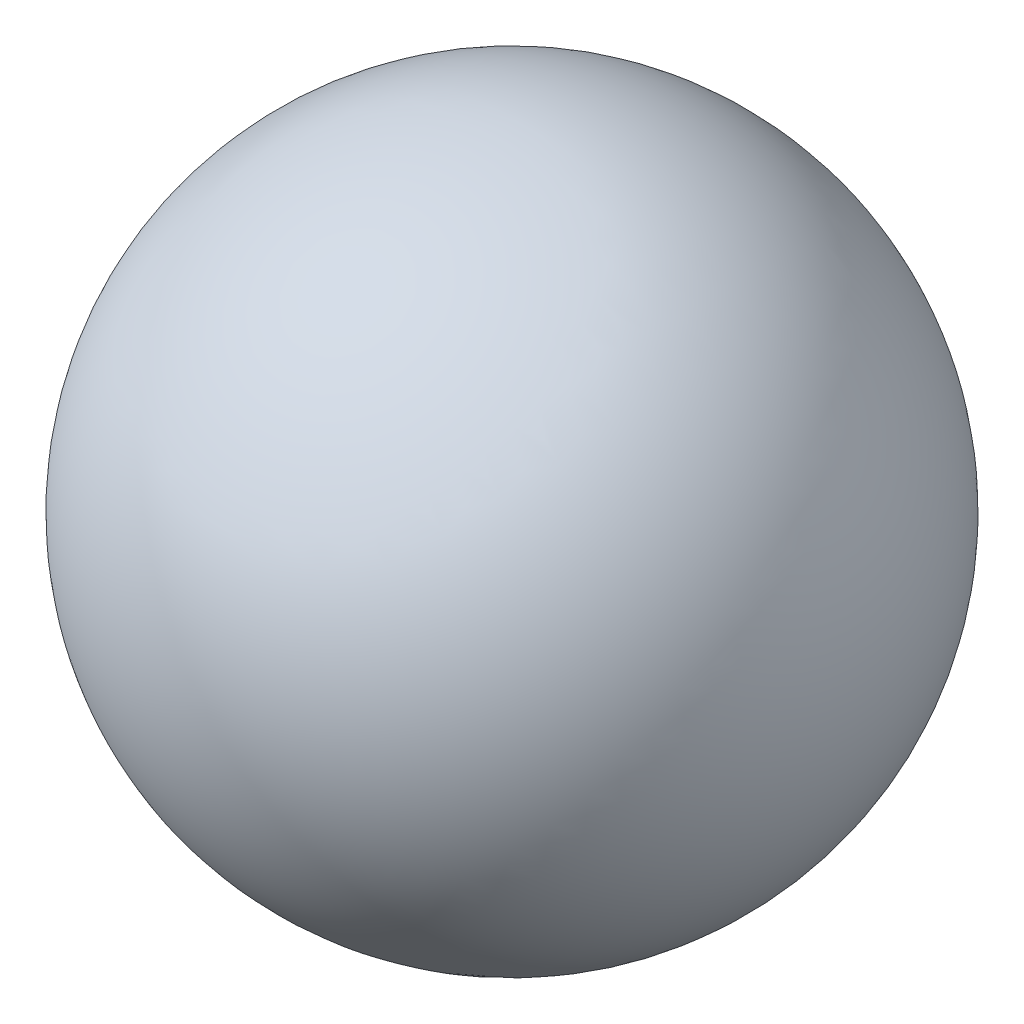
from build123d import *

# Parameters (mm, degrees)
SKETCH3_W          = 13
SKETCH3_H          = 25
CUT_EXTRUDE1_DEPTH = 27
FILLET1_R          = 4


with BuildPart() as part:
    # Sketch2 → Revolve1 (revolve)
    with BuildSketch(Plane(origin=(0, 0, 0), x_dir=(1, 0, 0), z_dir=(0, 1, 0))):
        with BuildLine():
            Line((0, -20), (0, 20))
            ThreePointArc((0, 20), (-20, 0), (0, -20))
        make_face()
    revolve(axis=Axis((0, 0, 20), (0, 0, -1)))

    # Sketch3 → Cut-Extrude1 (cut)
    with BuildSketch(Plane(origin=(0, 0, 0), x_dir=(1, 0, 0), z_dir=(0, 1, 0))):
        Rectangle(SKETCH3_W, SKETCH3_H)
    extrude(amount=-CUT_EXTRUDE1_DEPTH, mode=Mode.SUBTRACT)

    # Fillet1
    fillet1_edges = [part.edges().sort_by_distance(p)[0] for p in [
        (-6.5, -7.097534783, 12.5),
        (6.5, -7.097534783, 12.5),
        (6.5, -7.097534783, -12.5),
        (-6.5, -7.097534783, -12.5),
    ]]
    fillet(fillet1_edges, radius=FILLET1_R)


solid = part.part
